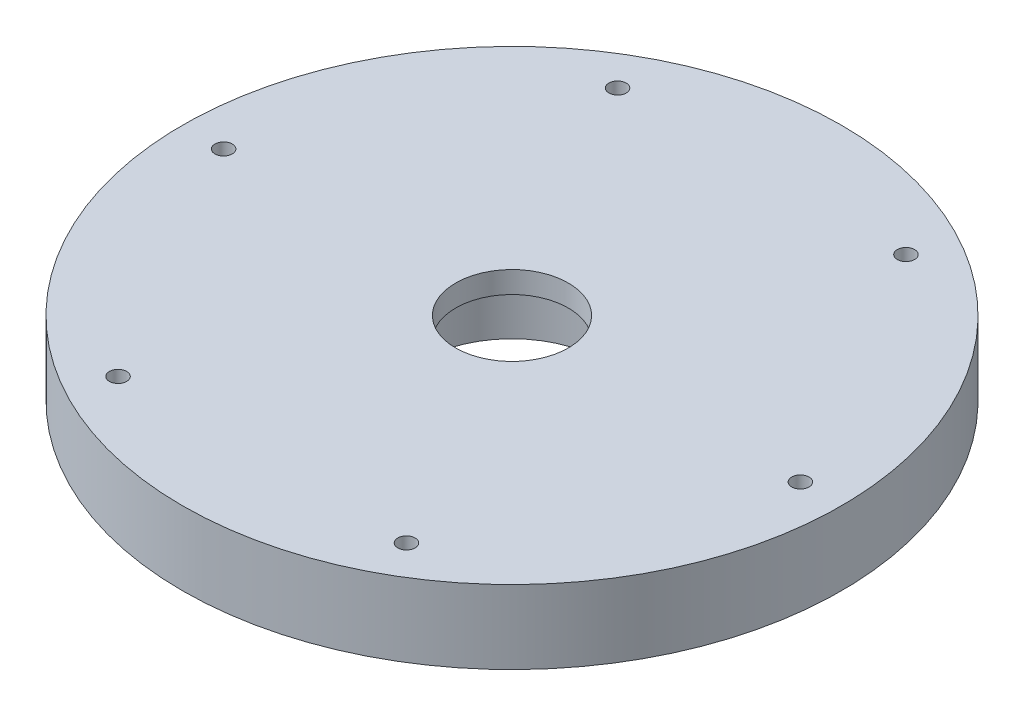
from build123d import *

# Parameters (mm, degrees)
SKETCH2_R          = 1
CUT_EXTRUDE1_DEPTH = 55.669601357


with BuildPart() as part:
    # Sketch1 → Revolve1 (revolve)
    with BuildSketch(Plane.XY):
        Polygon((-6.5, 0), (-38.0375, 0), (-38.0375, -8.5), (-35.0375, -8.5), (-35.0375, -9.75), (-10.5, -9.75), (-10.5, -2.5), (-6.5, -2.5), align=None)
    revolve(axis=Axis((0, 38.708668819, 0), (0, -1, 0)))

    # Sketch2 → Cut-Extrude1 (cut, through all)
    with BuildSketch(Plane.XZ.offset(9.75)):
        with Locations((-33.2875, 0)):
            Circle(SKETCH2_R)
        with Locations((-16.64375, 28.827820628)):
            Circle(SKETCH2_R)
        with Locations((16.64375, 28.827820628)):
            Circle(SKETCH2_R)
        with Locations((33.2875, 0)):
            Circle(SKETCH2_R)
        with Locations((16.64375, -28.827820628)):
            Circle(SKETCH2_R)
        with Locations((-16.64375, -28.827820628)):
            Circle(SKETCH2_R)
    extrude(amount=-CUT_EXTRUDE1_DEPTH, mode=Mode.SUBTRACT)


solid = part.part
